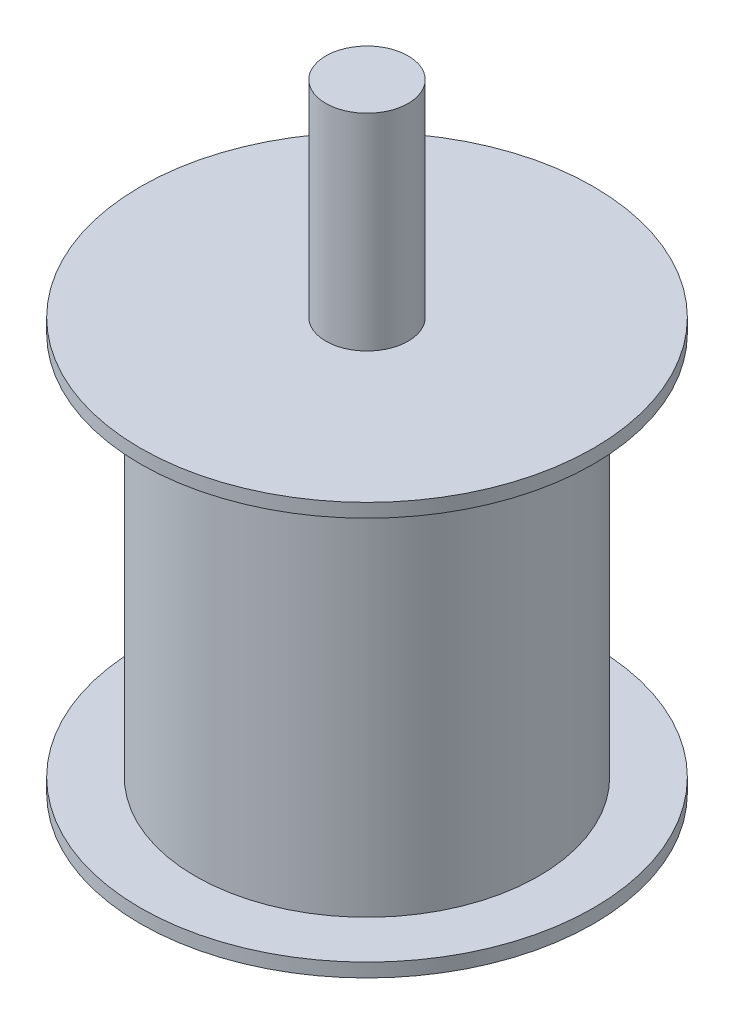
from build123d import *

# Parameters (mm, degrees)
ESQUISSE1_R             = 12.5
BOSS_EXTRU_1_DEPTH      = 30
ESQUISSE1_3_R           = 16.5
ESQUISSE1_3_R_2         = 12.5
BOSS_EXTRU_2_DEPTH      = 1
BOSS_EXTRU_3_START      = -1
ESQUISSE2_R             = 16.5
BOSS_EXTRU_3_DEPTH      = 1
ESQUISSE3_R             = 1.1525
ENL_V_MAT_EXTRU_1_DEPTH = 6
ESQUISSE4_R             = 3
BOSS_EXTRU_4_DEPTH      = 15


with BuildPart() as part:
    # Esquisse1 → Boss.-Extru.1 (new body)
    with BuildSketch(Plane(origin=(0, 0, 0), x_dir=(1, 0, 0), z_dir=(0, 1, 0))):
        Circle(ESQUISSE1_R)
    extrude(amount=BOSS_EXTRU_1_DEPTH)

    # Esquisse1<3> → Boss.-Extru.2 (add)
    with BuildSketch(Plane(origin=(0, 0, 0), x_dir=(1, 0, 0), z_dir=(0, 1, 0))):
        Circle(ESQUISSE1_3_R)
        Circle(ESQUISSE1_3_R_2, mode=Mode.SUBTRACT)
    extrude(amount=BOSS_EXTRU_2_DEPTH)

    # Esquisse2 → Boss.-Extru.3 (add)
    with BuildSketch(Plane(origin=(0, 30, 0), x_dir=(1, 0, 0), z_dir=(0, 1, 0)).offset(BOSS_EXTRU_3_START)):
        Circle(ESQUISSE2_R)
    extrude(amount=BOSS_EXTRU_3_DEPTH)

    # Esquisse3 → Enlèv. mat.-Extru.1 (cut)
    with BuildSketch(Plane.XZ):
        Circle(ESQUISSE3_R)
    extrude(amount=-ENL_V_MAT_EXTRU_1_DEPTH, mode=Mode.SUBTRACT)

    # Esquisse4 → Boss.-Extru.4 (add)
    with BuildSketch(Plane(origin=(0, 30, 0), x_dir=(1, 0, 0), z_dir=(0, 1, 0))):
        Circle(ESQUISSE4_R)
    extrude(amount=BOSS_EXTRU_4_DEPTH)


solid = part.part
